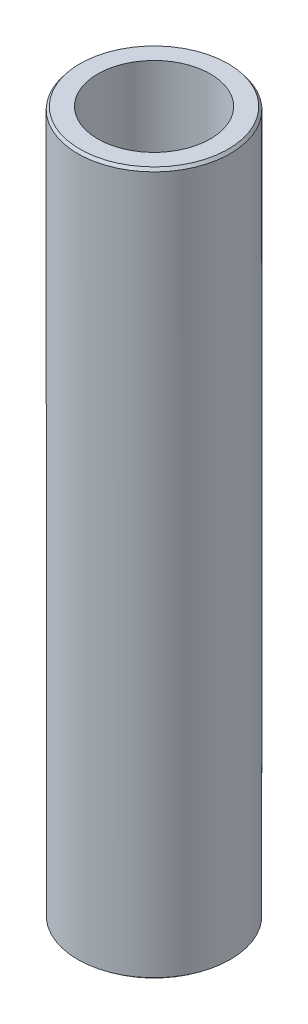
from build123d import *
from OCP.BRepFilletAPI import BRepFilletAPI_MakeChamfer

# Parameters (mm, degrees)
SKETCH1_R           = 50
BOSS_EXTRUDE1_DEPTH = 460.708989954
SKETCH2_R           = 36.920861845
CUT_EXTRUDE1_DEPTH  = 467.103822581
CHAMFER1_SIZE       = 1.825740849
CHAMFER1_SIZE2      = 1.439338172


with BuildPart() as part:
    # Sketch1 → Boss-Extrude1 (new body)
    with BuildSketch(Plane(origin=(0, 0, 0), x_dir=(1, 0, 0), z_dir=(0, 1, 0))):
        Circle(SKETCH1_R)
    extrude(amount=BOSS_EXTRUDE1_DEPTH)

    # Sketch2 → Cut-Extrude1 (cut, through all)
    with BuildSketch(Plane(origin=(0, 0, 0), x_dir=(1, 0, 0), z_dir=(0, 1, 0))):
        Circle(SKETCH2_R)
    extrude(amount=CUT_EXTRUDE1_DEPTH, mode=Mode.SUBTRACT)

    # Chamfer1: one chamfer whose edges measure the first distance from different faces: ONE call of the kernel's chamfer builder (chamfer() names one face for all edges)
    chamfer1_edges_1 = [part.edges().sort_by_distance(p)[0] for p in [
        (-50, 460.708989954, 0),
    ]]
    chamfer1_side_1 = [part.faces().sort_by_distance(p)[0] for p in [
        (-50, 230.354494977, 0),
    ]]
    chamfer1_edges_2 = [part.edges().sort_by_distance(p)[0] for p in [
        (-50, 0, 0),
    ]]
    chamfer1_side_2 = [part.faces().sort_by_distance(p)[0] for p in [
        (-48.585786438, 0, 0),
    ]]
    chamfer1 = BRepFilletAPI_MakeChamfer(part.part.solid().wrapped)
    for e in chamfer1_edges_1:
        chamfer1.Add(CHAMFER1_SIZE, CHAMFER1_SIZE2, e.wrapped, chamfer1_side_1[0].wrapped)  # the first distance lies on this face
    for e in chamfer1_edges_2:
        chamfer1.Add(CHAMFER1_SIZE, CHAMFER1_SIZE2, e.wrapped, chamfer1_side_2[0].wrapped)  # the first distance lies on this face
    add(Compound.cast(chamfer1.Shape()), mode=Mode.REPLACE)


solid = part.part
